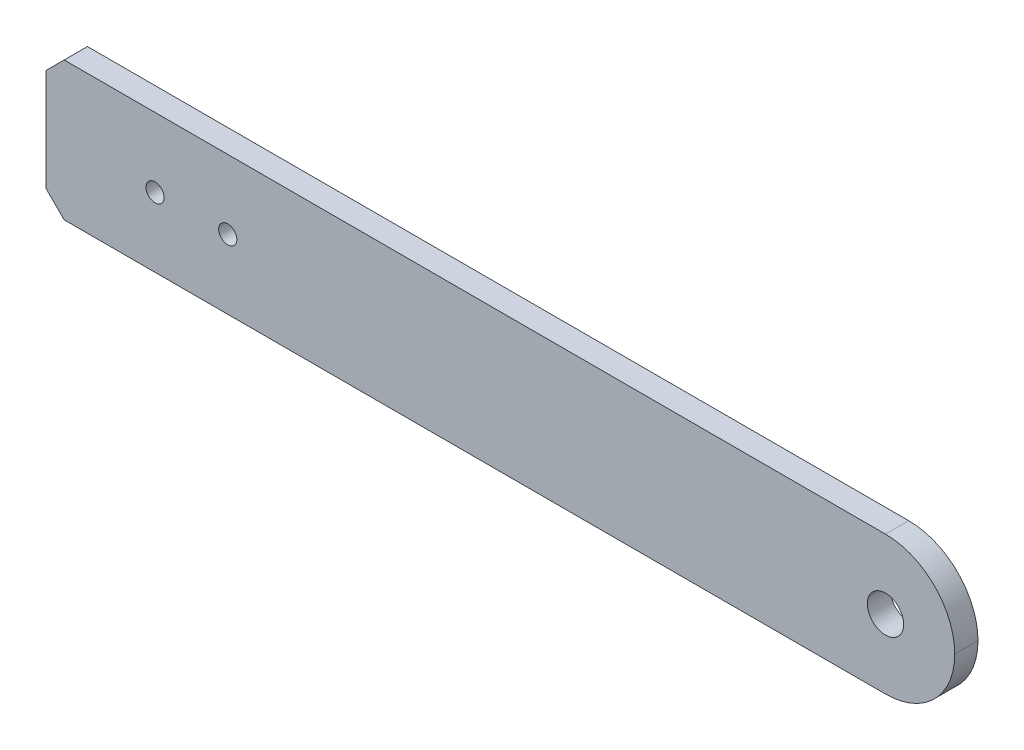
from build123d import *

# Parameters (mm, degrees)
BOSS_EXTRUDE1_DEPTH   = 6.4
F_5_0MM_DOWEL_HOLE1_D = 5
FILLET1_R             = 19.05
CUT_EXTRUDE1_REACH    = 128.605
SKETCH9_R             = 5


with BuildPart() as part:
    # Sketch1 → Boss-Extrude1 (new body)
    with BuildSketch(Plane.XY):
        Polygon((-120, 19.05), (125, 19.05), (125, -19.05), (-120, -19.05), (-125, -14.05), (-125, 14.05), align=None)
    extrude(amount=BOSS_EXTRUDE1_DEPTH)

    # Ø5.0mm Dowel Hole1 (through all)
    with Locations(Plane.XY.offset(6.4)):
        with Locations((-75, 0), (-95, 0)):
            Hole(F_5_0MM_DOWEL_HOLE1_D / 2)

    # Fillet1
    fillet1_edges = [part.edges().sort_by_distance(p)[0] for p in [
        (125, -19.05, 3.2),
        (125, 19.05, 3.2),
    ]]
    fillet(fillet1_edges, radius=FILLET1_R - 0.0001)  # a hair under: the kernel refuses the full size

    # Sketch9 → Cut-Extrude1 (cut, up to next)
    with BuildSketch(Plane.XY.offset(6.4), mode=Mode.PRIVATE) as cut_extrude1_sk1:
        with Locations((105.95, 0)):
            Circle(SKETCH9_R)
    cut_extrude1_tool1 = extrude(cut_extrude1_sk1.sketch, amount=-CUT_EXTRUDE1_REACH, mode=Mode.PRIVATE) & part.part
    add(cut_extrude1_tool1.solids().sort_by_distance((105.95, 0, 6.4))[0], mode=Mode.SUBTRACT)


solid = part.part
